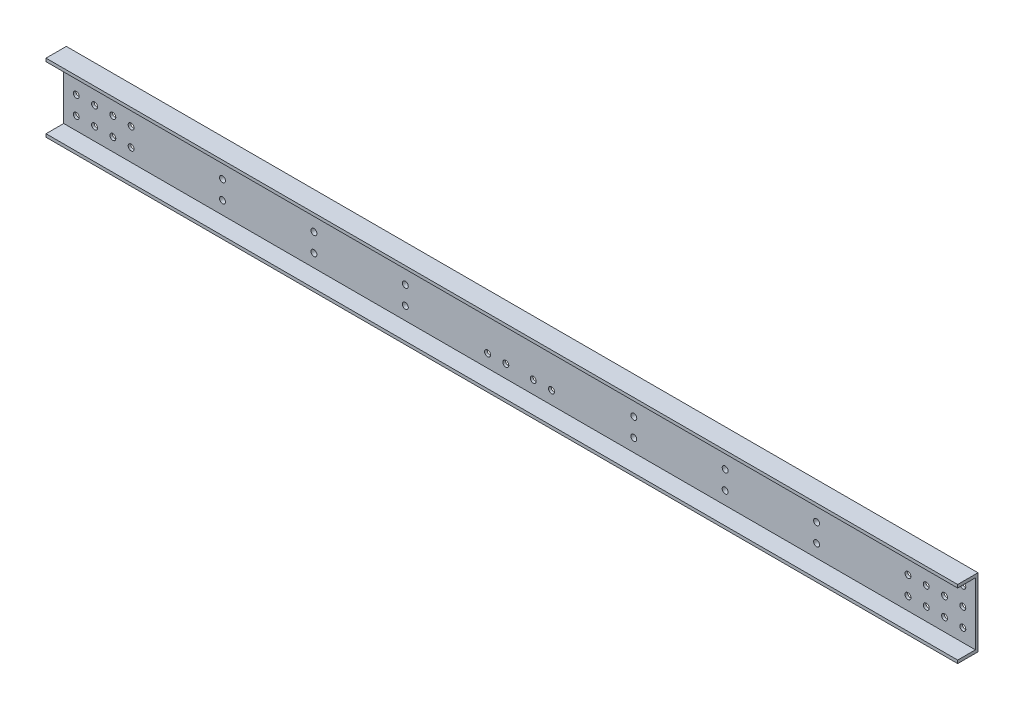
from build123d import *

# Parameters (mm, degrees)
SKETCH_1_W          = 3990
SKETCH_1_H          = 300
SKETCH_1_R          = 13
EXTRUDE_701_DEPTH   = 11.5
SKETCH_2_W          = 3990
SKETCH_2_H          = 13.5
EXTRUDE_1_DEPTH     = 77.5
SKETCH_3_W          = 70
SKETCH_3_H          = 230
EXTRUDE_2_DEPTH     = 16
SKETCH_4_R          = 13
CUT_EXTRUDE_1_DEPTH = 2004.38463606


with BuildPart() as part:
    # 草图1 → Extrude 701 (new body)
    with BuildSketch(Plane.XY):
        Rectangle(SKETCH_1_W, SKETCH_1_H)
        with Locations((1940, 0)):
            Circle(SKETCH_1_R, mode=Mode.SUBTRACT)
        with Locations((1860, 0)):
            Circle(SKETCH_1_R, mode=Mode.SUBTRACT)
        with Locations((1780, 0)):
            Circle(SKETCH_1_R, mode=Mode.SUBTRACT)
        with Locations((1700, 0)):
            Circle(SKETCH_1_R, mode=Mode.SUBTRACT)
        with Locations((1700, 80)):
            Circle(SKETCH_1_R, mode=Mode.SUBTRACT)
        with Locations((1780, 80)):
            Circle(SKETCH_1_R, mode=Mode.SUBTRACT)
        with Locations((1860, 80)):
            Circle(SKETCH_1_R, mode=Mode.SUBTRACT)
        with Locations((1940, 80)):
            Circle(SKETCH_1_R, mode=Mode.SUBTRACT)
        with Locations((1940, -80)):
            Circle(SKETCH_1_R, mode=Mode.SUBTRACT)
        with Locations((1860, -80)):
            Circle(SKETCH_1_R, mode=Mode.SUBTRACT)
        with Locations((1780, -80)):
            Circle(SKETCH_1_R, mode=Mode.SUBTRACT)
        with Locations((1700, -80)):
            Circle(SKETCH_1_R, mode=Mode.SUBTRACT)
        with Locations((-1700, -80)):
            Circle(SKETCH_1_R, mode=Mode.SUBTRACT)
        with Locations((-1780, -80)):
            Circle(SKETCH_1_R, mode=Mode.SUBTRACT)
        with Locations((-1860, -80)):
            Circle(SKETCH_1_R, mode=Mode.SUBTRACT)
        with Locations((-1940, -80)):
            Circle(SKETCH_1_R, mode=Mode.SUBTRACT)
        with Locations((-1940, 80)):
            Circle(SKETCH_1_R, mode=Mode.SUBTRACT)
        with Locations((-1860, 80)):
            Circle(SKETCH_1_R, mode=Mode.SUBTRACT)
        with Locations((-1780, 80)):
            Circle(SKETCH_1_R, mode=Mode.SUBTRACT)
        with Locations((-1700, 80)):
            Circle(SKETCH_1_R, mode=Mode.SUBTRACT)
        with Locations((-1700, 0)):
            Circle(SKETCH_1_R, mode=Mode.SUBTRACT)
        with Locations((-1780, 0)):
            Circle(SKETCH_1_R, mode=Mode.SUBTRACT)
        with Locations((-1860, 0)):
            Circle(SKETCH_1_R, mode=Mode.SUBTRACT)
        with Locations((-1940, 0)):
            Circle(SKETCH_1_R, mode=Mode.SUBTRACT)
        with Locations((60, 80)):
            Circle(SKETCH_1_R, mode=Mode.SUBTRACT)
        with Locations((140, 80)):
            Circle(SKETCH_1_R, mode=Mode.SUBTRACT)
        with Locations((140, -80)):
            Circle(SKETCH_1_R, mode=Mode.SUBTRACT)
        with Locations((60, -80)):
            Circle(SKETCH_1_R, mode=Mode.SUBTRACT)
        with Locations((-60, -80)):
            Circle(SKETCH_1_R, mode=Mode.SUBTRACT)
        with Locations((-140, -80)):
            Circle(SKETCH_1_R, mode=Mode.SUBTRACT)
        with Locations((-140, 80)):
            Circle(SKETCH_1_R, mode=Mode.SUBTRACT)
        with Locations((-60, 80)):
            Circle(SKETCH_1_R, mode=Mode.SUBTRACT)
    extrude(amount=EXTRUDE_701_DEPTH)

    # 草图2 → 凸台-拉伸1 (add)
    with BuildSketch(Plane.XY.offset(11.5)):
        with Locations((0, 143.25)):
            Rectangle(SKETCH_2_W, SKETCH_2_H)
        with Locations((0, -143.25)):
            Rectangle(SKETCH_2_W, SKETCH_2_H)
    extrude(amount=EXTRUDE_1_DEPTH)

    # 草图3 → 凸台-拉伸2 (add)
    with BuildSketch(Plane(origin=(0, 0, 0), x_dir=(-1, 0, 0), z_dir=(0, 0, -1))):
        with Locations((-1300, 0)):
            Rectangle(SKETCH_3_W, SKETCH_3_H)
        with Locations((-900, 0)):
            Rectangle(SKETCH_3_W, SKETCH_3_H)
        with Locations((-500, 0)):
            Rectangle(SKETCH_3_W, SKETCH_3_H)
        with Locations((500, 0)):
            Rectangle(SKETCH_3_W, SKETCH_3_H)
        with Locations((900, 0)):
            Rectangle(SKETCH_3_W, SKETCH_3_H)
        with Locations((1300, 0)):
            Rectangle(SKETCH_3_W, SKETCH_3_H)
    extrude(amount=EXTRUDE_2_DEPTH)

    # 草图4 → 切除-拉伸1 (cut, through all)
    with BuildSketch(Plane(origin=(0, 0, -16), x_dir=(-1, 0, 0), z_dir=(0, 0, -1))):
        with Locations((-1300, 0)):
            Circle(SKETCH_4_R)
        with Locations((-1300, 80)):
            Circle(SKETCH_4_R)
        with Locations((-900, 80)):
            Circle(SKETCH_4_R)
        with Locations((-900, 0)):
            Circle(SKETCH_4_R)
        with Locations((-500, 80)):
            Circle(SKETCH_4_R)
        with Locations((-500, 0)):
            Circle(SKETCH_4_R)
        with Locations((-500, -80)):
            Circle(SKETCH_4_R)
        with Locations((-900, -80)):
            Circle(SKETCH_4_R)
        with Locations((-1300, -80)):
            Circle(SKETCH_4_R)
        with Locations((1300, -80)):
            Circle(SKETCH_4_R)
        with Locations((900, -80)):
            Circle(SKETCH_4_R)
        with Locations((500, -80)):
            Circle(SKETCH_4_R)
        with Locations((500, 0)):
            Circle(SKETCH_4_R)
        with Locations((500, 80)):
            Circle(SKETCH_4_R)
        with Locations((900, 0)):
            Circle(SKETCH_4_R)
        with Locations((900, 80)):
            Circle(SKETCH_4_R)
        with Locations((1300, 80)):
            Circle(SKETCH_4_R)
        with Locations((1300, 0)):
            Circle(SKETCH_4_R)
    extrude(amount=-CUT_EXTRUDE_1_DEPTH, mode=Mode.SUBTRACT)


solid = part.part
